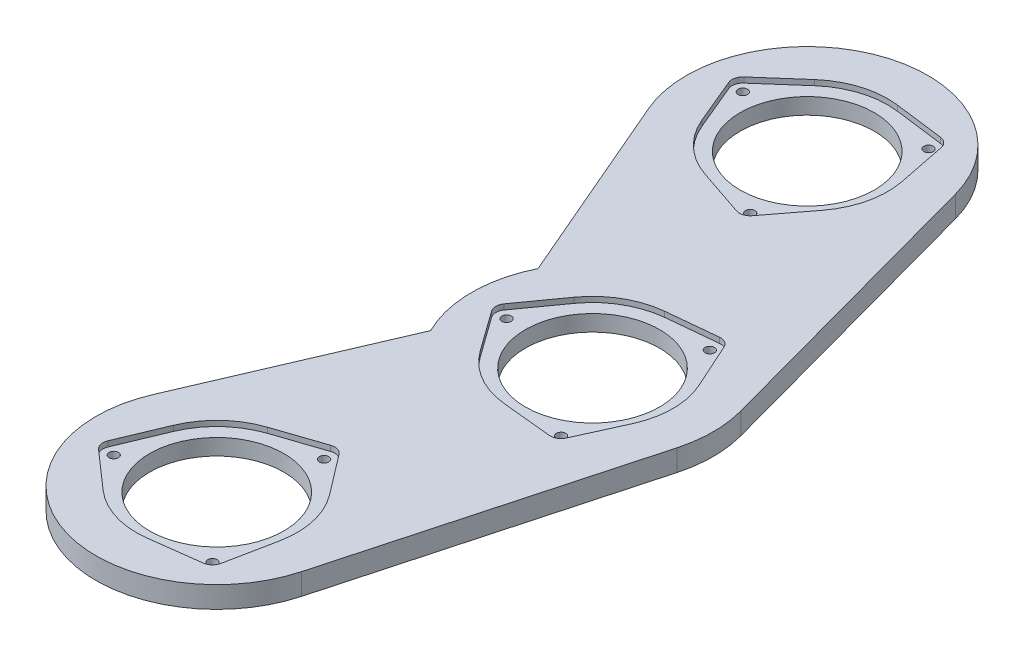
from build123d import *

# Parameters (mm, degrees)
SALIENTE_EXTRUIR1_DEPTH    = 8
CORTAR_EXTRUIR2_DEPTH      = 2
CORTAR_EXTRUIR3_DEPTH      = 173.296256489
CORTAR_EXTRUIR3_DEPTH_BACK = 173.296256489
CROQUIS7_R                 = 25
CROQUIS7_R_2               = 1.75


with BuildPart() as part:
    # Croquis1 → Saliente-Extruir1 (new body)
    with BuildSketch(Plane(origin=(0, 0, 0), x_dir=(1, 0, 0), z_dir=(0, 1, 0))):
        with BuildLine():
            Line((-71.345800689, 92.236983213), (-40.311288741, 20))
            ThreePointArc((-40.311288741, 20), (-45, 0), (-40.311288741, -20))
            Line((-40.311288741, -20), (-71.345800689, -92.236983213))
            ThreePointArc((-71.345800689, -92.236983213), (-44.837742086, -152.483425118), (13.414371956, -121.840283261))
            Line((13.414371956, -121.840283261), (43.414371956, -11.840283261))
            ThreePointArc((43.414371956, -11.840283261), (45, 0), (43.414371956, 11.840283261))
            Line((43.414371956, 11.840283261), (13.414371956, 121.840283261))
            ThreePointArc((13.414371956, 121.840283261), (-44.837742086, 152.483425118), (-71.345800689, 92.236983213))
        make_face()
    extrude(amount=SALIENTE_EXTRUIR1_DEPTH)

    # Croquis6 → Cortar-Extruir2 (cut)
    with BuildSketch(Plane(origin=(0, 8, 0), x_dir=(1, 0, 0), z_dir=(0, 1, 0))):
        with BuildLine():
            Line((-17.463943171, -76.972022781), (-6.148782918, -91.803312288))
            ThreePointArc((-6.148782918, -91.803312288), (-0.768898056, -103.25146837), (-0.585765229, -115.899389193))
            Line((-0.585765229, -115.899389193), (-4.254154509, -134.189903678))
            ThreePointArc((-4.254154509, -134.189903678), (-5.448059038, -136.328733258), (-7.664961107, -137.370532287))
            Line((-7.664961107, -137.370532287), (-26.166814718, -139.754103761))
            ThreePointArc((-26.166814718, -139.754103761), (-38.771151142, -138.689142679), (-49.816138294, -132.523779948))
            Line((-49.816138294, -132.523779948), (-63.821993846, -120.201604399))
            ThreePointArc((-63.821993846, -120.201604399), (-65.077322332, -118.098237956), (-64.871095722, -115.657444933))
            Line((-64.871095722, -115.657444933), (-57.684402365, -98.442583952))
            ThreePointArc((-57.684402365, -98.442583952), (-50.459950802, -88.059388951), (-39.598096477, -81.576830859))
            Line((-39.598096477, -81.576830859), (-21.923851646, -75.608491924))
            ThreePointArc((-21.923851646, -75.608491924), (-19.47461863, -75.573028785), (-17.463943171, -76.972022781))
        make_face()
        with BuildLine():
            Line((-24.375, -17.488835725), (-35.25, -2.331844763))
            ThreePointArc((-35.25, -2.331844763), (-36, 0), (-35.25, 2.331844763))
            Line((-35.25, 2.331844763), (-24.375, 17.488835725))
            ThreePointArc((-24.375, 17.488835725), (-15, 25.980762114), (-2.95827602, 29.85378708))
            Line((-2.95827602, 29.85378708), (15.605563197, 31.693317865))
            ThreePointArc((15.605563197, 31.693317865), (18, 31.176914536), (19.644436803, 29.361473102))
            Line((19.644436803, 29.361473102), (27.33327602, 12.364951355))
            ThreePointArc((27.33327602, 12.364951355), (30, 0), (27.33327602, -12.364951355))
            Line((27.33327602, -12.364951355), (19.644436803, -29.361473102))
            ThreePointArc((19.644436803, -29.361473102), (18, -31.176914536), (15.605563197, -31.693317865))
            Line((15.605563197, -31.693317865), (-2.95827602, -29.85378708))
            ThreePointArc((-2.95827602, -29.85378708), (-15, -25.980762114), (-24.375, -17.488835725))
        make_face()
        with BuildLine():
            Line((-64.871095722, 115.657444933), (-57.684402365, 98.442583952))
            ThreePointArc((-57.684402365, 98.442583952), (-50.459950802, 88.059388951), (-39.598096477, 81.576830859))
            Line((-39.598096477, 81.576830859), (-21.923851646, 75.608491924))
            ThreePointArc((-21.923851646, 75.608491924), (-19.47461863, 75.573028785), (-17.463943171, 76.972022781))
            Line((-17.463943171, 76.972022781), (-6.148782918, 91.803312288))
            ThreePointArc((-6.148782918, 91.803312288), (-0.768898056, 103.25146837), (-0.585765229, 115.899389193))
            Line((-0.585765229, 115.899389193), (-4.254154509, 134.189903678))
            ThreePointArc((-4.254154509, 134.189903678), (-5.448059038, 136.328733258), (-7.664961107, 137.370532287))
            Line((-7.664961107, 137.370532287), (-26.166814718, 139.754103761))
            ThreePointArc((-26.166814718, 139.754103761), (-38.771151142, 138.689142679), (-49.816138294, 132.523779948))
            Line((-49.816138294, 132.523779948), (-63.821993846, 120.201604399))
            ThreePointArc((-63.821993846, 120.201604399), (-65.077322332, 118.098237956), (-64.871095722, 115.657444933))
        make_face()
    extrude(amount=-CORTAR_EXTRUIR2_DEPTH, mode=Mode.SUBTRACT)

    # Croquis7 → Cortar-Extruir3 (cut, two sides: drawn at the far end of the back side and taken through both)
    with BuildSketch(Plane(origin=(0, 6, 0), x_dir=(1, 0, 0), z_dir=(0, 1, 0)).offset(-CORTAR_EXTRUIR3_DEPTH_BACK)):
        with Locations((-30, 110)):
            Circle(CROQUIS7_R)
        with Locations((-30, -110)):
            Circle(CROQUIS7_R)
        Circle(CROQUIS7_R)
        with Locations((-61.179842073, 117.198433739)):
            Circle(CROQUIS7_R_2)
        with Locations((-8.176052478, 133.403318452)):
            Circle(CROQUIS7_R_2)
        with Locations((-20.644105449, 79.398247809)):
            Circle(CROQUIS7_R_2)
        with Locations((16, 27.712812921)):
            Circle(CROQUIS7_R_2)
        with Locations((-32, 0)):
            Circle(CROQUIS7_R_2)
        with Locations((16, -27.712812921)):
            Circle(CROQUIS7_R_2)
        with Locations((-8.176052478, -133.403318452)):
            Circle(CROQUIS7_R_2)
        with Locations((-61.179842073, -117.198433739)):
            Circle(CROQUIS7_R_2)
        with Locations((-20.644105449, -79.398247809)):
            Circle(CROQUIS7_R_2)
    extrude(amount=CORTAR_EXTRUIR3_DEPTH + CORTAR_EXTRUIR3_DEPTH_BACK, mode=Mode.SUBTRACT)


solid = part.part
